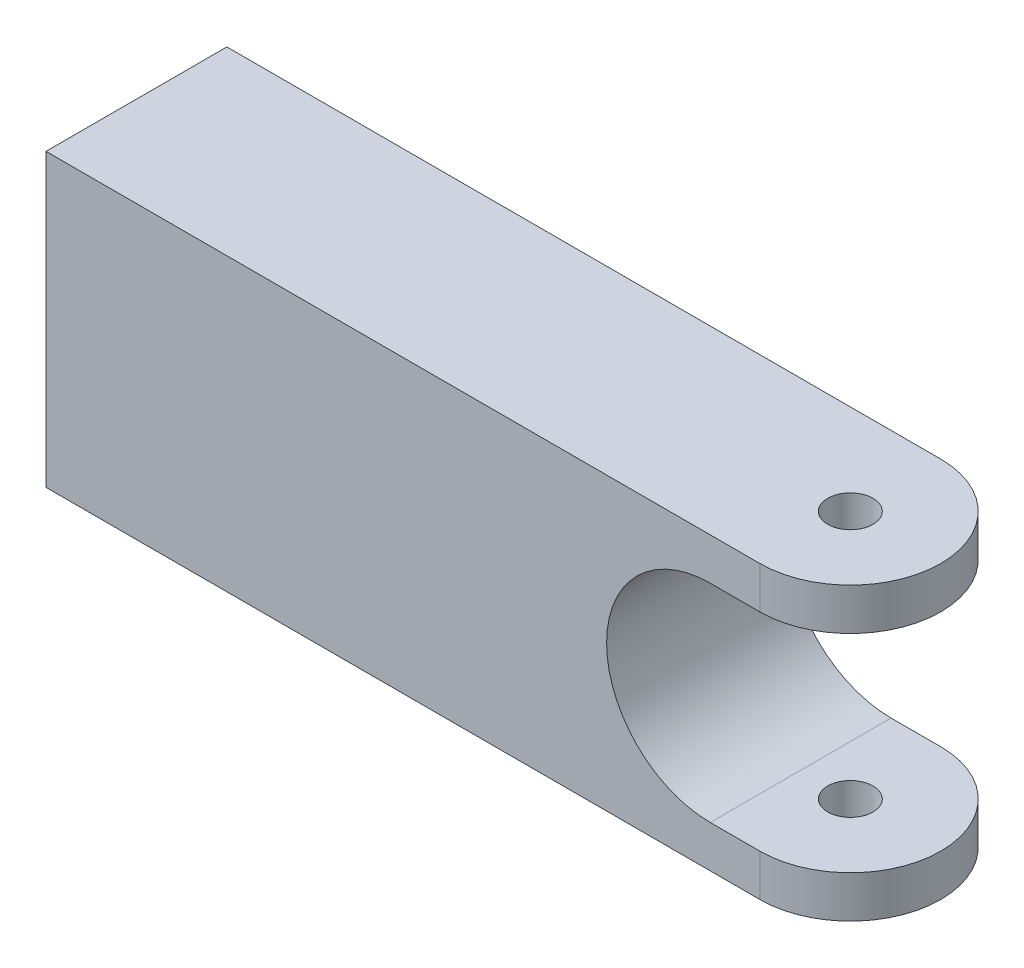
from build123d import *

# Parameters (mm, degrees)
BOSS_EXTRUDE1_DEPTH = 18.8468
SKETCH3_R           = 2.35585
CUT_EXTRUDE1_DEPTH  = 92.108493523


with BuildPart() as part:
    # Sketch1 → Boss-Extrude1 (new body)
    with BuildSketch(Plane.XY):
        with BuildLine():
            Line((0, 0), (83.82, 0))
            Line((83.82, 0), (83.82, -4.3688))
            Line((83.82, -4.3688), (69.215, -4.3688))
            ThreePointArc((69.215, -4.3688), (58.42, -15.1638), (69.215, -25.9588))
            Line((69.215, -25.9588), (83.82, -25.9588))
            Line((83.82, -25.9588), (83.82, -30.3276))
            Line((83.82, -30.3276), (0, -30.3276))
            Line((0, -30.3276), (0, 0))
        make_face()
    extrude(amount=BOSS_EXTRUDE1_DEPTH)

    # Sketch3 → Cut-Extrude1 (cut, through all)
    with BuildSketch(Plane(origin=(0, 0, 0), x_dir=(1, 0, 0), z_dir=(0, 1, 0))):
        with Locations((74.3966, -9.4234)):
            Circle(SKETCH3_R)
        with BuildLine():
            Line((85.1916, -18.8468), (74.3966, -18.8468))
            ThreePointArc((74.3966, -18.8468), (83.82, -9.4234), (74.3966, 0))
            Line((74.3966, 0), (85.1916, 0))
            Line((85.1916, 0), (85.1916, -18.8468))
        make_face()
    extrude(amount=-CUT_EXTRUDE1_DEPTH, mode=Mode.SUBTRACT)


solid = part.part
